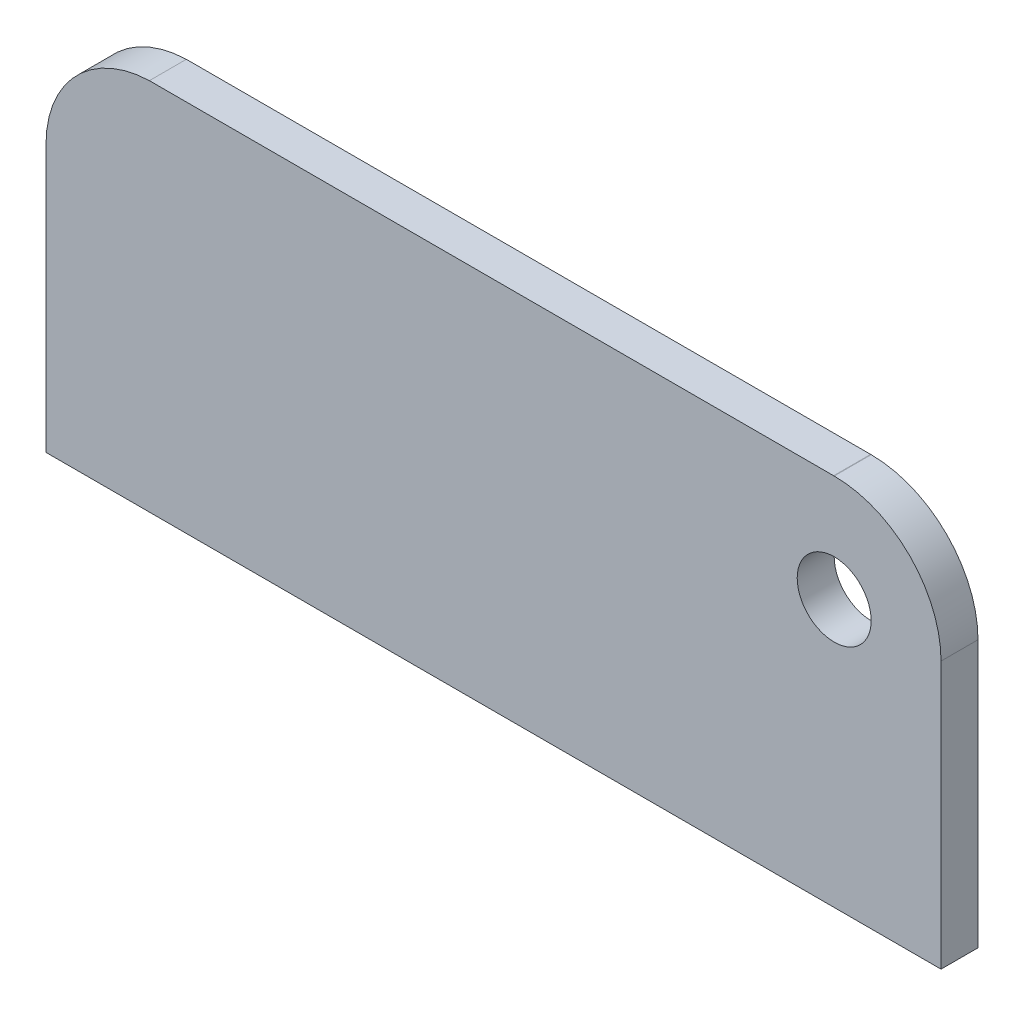
from build123d import *

# Parameters (mm, degrees)
SKETCH1_W           = 6.477
SKETCH1_H           = 19.812
SKETCH1_R           = 1.5
SKETCH1_W_2         = 52.832
SKETCH1_H_2         = 5
BOSS_EXTRUDE2_DEPTH = 3.175
SKETCH3_W           = 30
SKETCH3_H           = 29.812
BOSS_EXTRUDE3_DEPTH = 3.175
SKETCH4_R           = 3.175
CUT_EXTRUDE1_DEPTH  = 10
SKETCH5_W           = 56.703294506
SKETCH5_H           = 29.812
BOSS_EXTRUDE4_DEPTH = 3.175
BOSS_EXTRUDE6_DEPTH = 3.175
CUT_EXTRUDE3_DEPTH  = 10
SKETCH11_R          = 3.175
BOSS_EXTRUDE7_DEPTH = 3.175
CUT_EXTRUDE4_START  = -3.175
CUT_EXTRUDE4_DEPTH  = 3.175
SKETCH13_R          = 3.175
BOSS_EXTRUDE8_DEPTH = 3.175


# Read off the part's stored shape, not the designer's step: Cut-Extrude4
with BuildPart() as part:
    # Sketch1 → Boss-Extrude2 (new body)
    # profile 1 of 4: a face of its own
    with BuildSketch(Plane.XY):
        with Locations((-23.1775, 0)):
            Rectangle(SKETCH1_W, SKETCH1_H)
        with Locations((-23.622, -5.08)):
            Circle(SKETCH1_R, mode=Mode.SUBTRACT)
        with Locations((-23.622, 5.08)):
            Circle(SKETCH1_R, mode=Mode.SUBTRACT)
    # profile 2 of 4: a face of its own
    with BuildSketch(Plane.XY):
        with Locations((23.1775, 0)):
            Rectangle(SKETCH1_W, SKETCH1_H)
        with Locations((23.622, -5.08)):
            Circle(SKETCH1_R, mode=Mode.SUBTRACT)
        with Locations((23.622, 5.08)):
            Circle(SKETCH1_R, mode=Mode.SUBTRACT)
    # profile 3 of 4: a face of its own
    with BuildSketch(Plane.XY):
        with Locations((0, 12.406)):
            Rectangle(SKETCH1_W_2, SKETCH1_H_2)
    # profile 4 of 4: a face of its own
    with BuildSketch(Plane.XY):
        with Locations((0, -12.406)):
            Rectangle(SKETCH1_W_2, SKETCH1_H_2)
    extrude(amount=BOSS_EXTRUDE2_DEPTH)

    # Sketch3 → Boss-Extrude3 (add)
    with BuildSketch(Plane.XY.offset(3.175)):
        with Locations((41.416, 0)):
            Rectangle(SKETCH3_W, SKETCH3_H)
    extrude(amount=-BOSS_EXTRUDE3_DEPTH)

    # Sketch4 → Cut-Extrude1 (cut)
    with BuildSketch(Plane(origin=(0, 0, 0), x_dir=(-1, 0, 0), z_dir=(0, 0, -1))):
        with Locations((-41.266, 8.006)):
            Circle(SKETCH4_R)
    extrude(amount=-CUT_EXTRUDE1_DEPTH, mode=Mode.SUBTRACT)

    # Sketch5 → Boss-Extrude4 (add)
    with BuildSketch(Plane(origin=(0, 0, 0), x_dir=(-1, 0, 0), z_dir=(0, 0, -1))):
        with Locations((-1.935647253, 0)):
            Rectangle(SKETCH5_W, SKETCH5_H)
    extrude(amount=-BOSS_EXTRUDE4_DEPTH)

    # Sketch8 → Boss-Extrude6 (add)
    with BuildSketch(Plane(origin=(0, 0, 0), x_dir=(-1, 0, 0), z_dir=(0, 0, -1))):
        with BuildLine():
            ThreePointArc((-21.596379237, 14.906), (-31.366874619, 16.599566662), (-41.266, 17.181))
            ThreePointArc((-41.266, 17.181), (-44.496566901, 16.593436317), (-47.313365129, 14.906))
            Line((-47.313365129, 14.906), (-21.596379237, 14.906))
        make_face()
    extrude(amount=-BOSS_EXTRUDE6_DEPTH)

    # Sketch9 → Cut-Extrude3 (cut)
    with BuildSketch(Plane(origin=(0, 0, 0), x_dir=(-1, 0, 0), z_dir=(0, 0, -1))):
        with BuildLine():
            Line((-50.441, -14.906), (-50.441, 8.006))
            ThreePointArc((-50.441, 8.006), (-49.622590215, 11.79387869), (-47.313365129, 14.906))
            Line((-47.313365129, 14.906), (-56.416, 14.906))
            Line((-56.416, 14.906), (-56.416, -14.906))
            Line((-56.416, -14.906), (-50.441, -14.906))
        make_face()
        with BuildLine():
            ThreePointArc((-21.596379237, 14.906), (4.87312141, 3.967175073), (26.416, -14.906))
            Line((26.416, -14.906), (26.416, 14.906))
            Line((26.416, 14.906), (-21.596379237, 14.906))
        make_face()
    extrude(amount=-CUT_EXTRUDE3_DEPTH, mode=Mode.SUBTRACT)

    # Sketch11 → Boss-Extrude7 (add)
    with BuildSketch(Plane(origin=(0, 0, 0), x_dir=(-1, 0, 0), z_dir=(0, 0, -1))):
        with BuildLine():
            ThreePointArc((-41.266, 17.181), (-3.83303759, 8.714126043), (26.416, -14.906))
            Line((26.416, -14.906), (26.416, 17.181))
            Line((26.416, 17.181), (-41.266, 17.181))
        make_face()
        with Locations((17.236, 8.006)):
            Circle(SKETCH11_R, mode=Mode.SUBTRACT)
    extrude(amount=-BOSS_EXTRUDE7_DEPTH)

    # Cut-Extrude4 outline → Cut-Extrude4 (cut)
    with BuildSketch(Plane(origin=(0, 0, 0), x_dir=(-1, 0, 0), z_dir=(0, 0, -1)).offset(CUT_EXTRUDE4_START)):
        with BuildLine():
            ThreePointArc((17.538943889, 17.181), (23.833477734, 14.389234881), (26.416, 8.006))
            Line((26.416, 8.006), (26.416, 17.181))
            Line((26.416, 17.181), (17.538943889, 17.181))
        make_face()
    extrude(amount=CUT_EXTRUDE4_DEPTH, mode=Mode.SUBTRACT)

    # Sketch13 → Boss-Extrude8 (add)
    with BuildSketch(Plane(origin=(0, 0, 0), x_dir=(-1, 0, 0), z_dir=(0, 0, -1))):
        with Locations((17.236, 8.006)):
            Circle(SKETCH13_R)
    extrude(amount=-BOSS_EXTRUDE8_DEPTH)


solid = part.part
